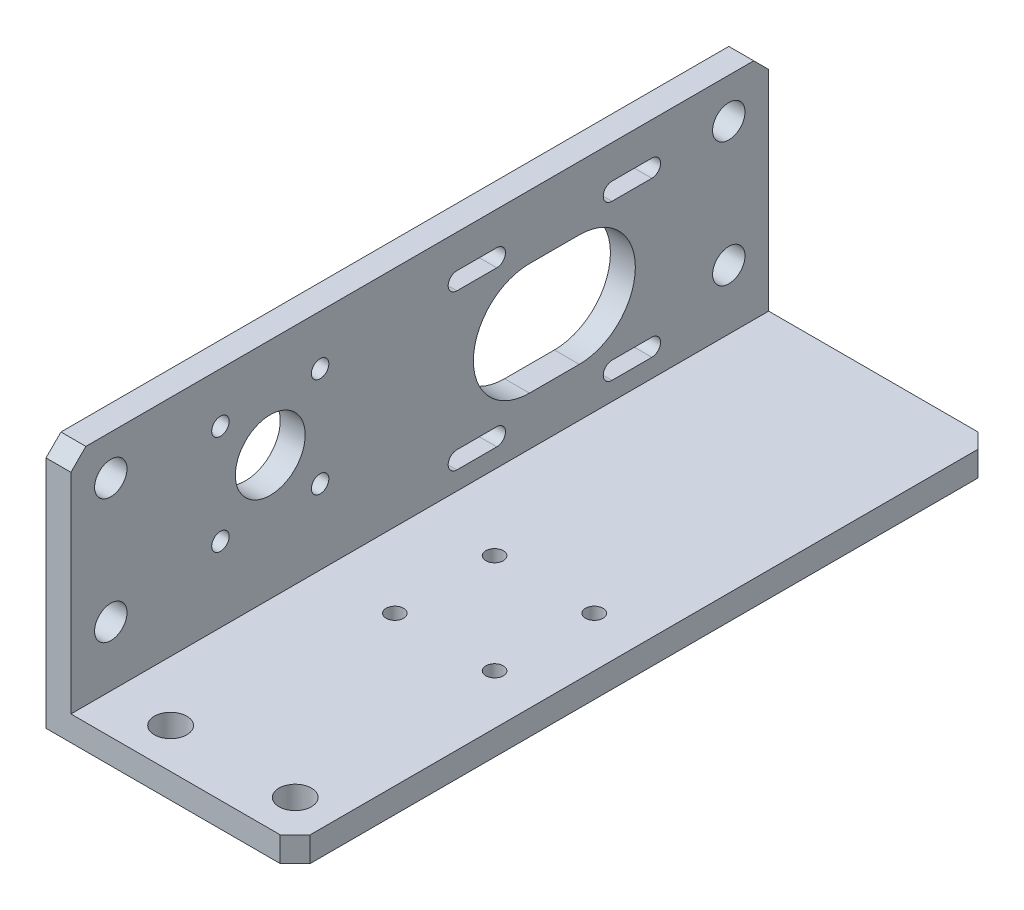
from build123d import *

# Parameters (mm, degrees)
ESTRUSIONE_ESTRUSIONE1_DEPTH = 140
FORO_6_5_6_5_1_D             = 6.5
FORO_6_5_6_5_2_AT_2_COUNT    = 2
FORO_6_5_6_5_2_AT_2_PITCH    = 25
TAGLIO_ESTRUSIONE1_REACH     = 158.844
SCHIZZO8_R                   = 1.75
TAGLIO_ESTRUSIONE2_REACH     = 158.844
SCHIZZO9_R                   = 1.75
SCHIZZO9_R_2                 = 7
TAGLIO_ESTRUSIONE4_REACH     = 158.844
SMUSSO1_SIZE                 = 3


with BuildPart() as part:
    # Schizzo1 → Estrusione-Estrusione1 (new body)
    with BuildSketch(Plane.XY):
        Polygon((0, 0), (0, 50), (5, 50), (5, 5), (50, 5), (50, 0), align=None)
    extrude(amount=ESTRUSIONE_ESTRUSIONE1_DEPTH)

    # Foro Ø6.5 (6.5)-1 (through all)
    with Locations(Plane(origin=(0, 0, 0), x_dir=(-1, 0, 0), z_dir=(0, -1, 0))):
        with Locations((-17, -132), (-42, -132)):
            Hole(FORO_6_5_6_5_1_D / 2)

    # Schizzo6 → Foro Ø6.5 (6.5)-2 (revolve, cut)
    with BuildSketch(Plane(origin=(0, 42, 132), x_dir=(0, 0, 1), z_dir=(0, 1, 0))):
        Polygon((0, 0), (0, 6.952797012), (3.25, 5), (3.25, 0), align=None)
    foro_6_5_6_5_2 = revolve(axis=Axis((-6.35, 42, 132), (1, 0, 0)), mode=Mode.SUBTRACT)

    # Foro Ø6.5 (6.5)-2 at 2: Foro Ø6.5 (6.5)-2 ×2
    with Locations(*[(0, -i * FORO_6_5_6_5_2_AT_2_PITCH, 0) for i in range(1, FORO_6_5_6_5_2_AT_2_COUNT)]):
        add(foro_6_5_6_5_2, mode=Mode.SUBTRACT)

    # Specchia1: Foro Ø6.5 (6.5)-2 across plane
    add(foro_6_5_6_5_2.mirror(Plane.XY.offset(70)), mode=Mode.SUBTRACT)

    # Specchia1 copy 1 sketch → Specchia1 copy 1 (revolve, cut)
    with BuildSketch(Plane(origin=(0, 17, 8), x_dir=(0, 0, -1), z_dir=(0, 1, 0))):
        Polygon((0, 0), (0, -6.952797012), (3.25, -5), (3.25, 0), align=None)
    revolve(axis=Axis((-6.35, 17, 8), (-1, 0, 0)), mode=Mode.SUBTRACT)

    # Schizzo8 → Taglio-Estrusione1 (cut, up to next)
    with BuildSketch(Plane.XZ, mode=Mode.PRIVATE) as taglio_estrusione1_sk1:
        with Locations((20, 70)):
            Circle(SCHIZZO8_R)
    taglio_estrusione1_tool1 = extrude(taglio_estrusione1_sk1.sketch, amount=-TAGLIO_ESTRUSIONE1_REACH, mode=Mode.PRIVATE) & part.part
    # Schizzo8 → Taglio-Estrusione1 (cut, up to next)
    with BuildSketch(Plane.XZ, mode=Mode.PRIVATE) as taglio_estrusione1_sk2:
        with Locations((20, 90)):
            Circle(SCHIZZO8_R)
    taglio_estrusione1_tool2 = extrude(taglio_estrusione1_sk2.sketch, amount=-TAGLIO_ESTRUSIONE1_REACH, mode=Mode.PRIVATE) & part.part
    # Schizzo8 → Taglio-Estrusione1 (cut, up to next)
    with BuildSketch(Plane.XZ, mode=Mode.PRIVATE) as taglio_estrusione1_sk3:
        with Locations((40, 90)):
            Circle(SCHIZZO8_R)
    taglio_estrusione1_tool3 = extrude(taglio_estrusione1_sk3.sketch, amount=-TAGLIO_ESTRUSIONE1_REACH, mode=Mode.PRIVATE) & part.part
    # Schizzo8 → Taglio-Estrusione1 (cut, up to next)
    with BuildSketch(Plane.XZ, mode=Mode.PRIVATE) as taglio_estrusione1_sk4:
        with Locations((40, 70)):
            Circle(SCHIZZO8_R)
    taglio_estrusione1_tool4 = extrude(taglio_estrusione1_sk4.sketch, amount=-TAGLIO_ESTRUSIONE1_REACH, mode=Mode.PRIVATE) & part.part
    add(taglio_estrusione1_tool1.solids().sort_by_distance((20, 0, 70))[0], mode=Mode.SUBTRACT)
    add(taglio_estrusione1_tool2.solids().sort_by_distance((20, 0, 90))[0], mode=Mode.SUBTRACT)
    add(taglio_estrusione1_tool3.solids().sort_by_distance((40, 0, 90))[0], mode=Mode.SUBTRACT)
    add(taglio_estrusione1_tool4.solids().sort_by_distance((40, 0, 70))[0], mode=Mode.SUBTRACT)

    # Schizzo9 → Taglio-Estrusione2 (cut, up to next)
    with BuildSketch(Plane.ZY, mode=Mode.PRIVATE) as taglio_estrusione2_sk1:
        with Locations((90, 40)):
            Circle(SCHIZZO9_R)
    taglio_estrusione2_tool1 = extrude(taglio_estrusione2_sk1.sketch, amount=-TAGLIO_ESTRUSIONE2_REACH, mode=Mode.PRIVATE) & part.part
    # Schizzo9 → Taglio-Estrusione2 (cut, up to next)
    with BuildSketch(Plane.ZY, mode=Mode.PRIVATE) as taglio_estrusione2_sk2:
        with Locations((110, 40)):
            Circle(SCHIZZO9_R)
    taglio_estrusione2_tool2 = extrude(taglio_estrusione2_sk2.sketch, amount=-TAGLIO_ESTRUSIONE2_REACH, mode=Mode.PRIVATE) & part.part
    # Schizzo9 → Taglio-Estrusione2 (cut, up to next)
    with BuildSketch(Plane.ZY, mode=Mode.PRIVATE) as taglio_estrusione2_sk3:
        with Locations((110, 20)):
            Circle(SCHIZZO9_R)
    taglio_estrusione2_tool3 = extrude(taglio_estrusione2_sk3.sketch, amount=-TAGLIO_ESTRUSIONE2_REACH, mode=Mode.PRIVATE) & part.part
    # Schizzo9 → Taglio-Estrusione2 (cut, up to next)
    with BuildSketch(Plane.ZY, mode=Mode.PRIVATE) as taglio_estrusione2_sk4:
        with Locations((90, 20)):
            Circle(SCHIZZO9_R)
    taglio_estrusione2_tool4 = extrude(taglio_estrusione2_sk4.sketch, amount=-TAGLIO_ESTRUSIONE2_REACH, mode=Mode.PRIVATE) & part.part
    # Schizzo9 → Taglio-Estrusione2 (cut, up to next)
    with BuildSketch(Plane.ZY, mode=Mode.PRIVATE) as taglio_estrusione2_sk5:
        with Locations((100, 30)):
            Circle(SCHIZZO9_R_2)
    taglio_estrusione2_tool5 = extrude(taglio_estrusione2_sk5.sketch, amount=-TAGLIO_ESTRUSIONE2_REACH, mode=Mode.PRIVATE) & part.part
    add(taglio_estrusione2_tool1.solids().sort_by_distance((0, 40, 90))[0], mode=Mode.SUBTRACT)
    add(taglio_estrusione2_tool2.solids().sort_by_distance((0, 40, 110))[0], mode=Mode.SUBTRACT)
    add(taglio_estrusione2_tool3.solids().sort_by_distance((0, 20, 110))[0], mode=Mode.SUBTRACT)
    add(taglio_estrusione2_tool4.solids().sort_by_distance((0, 20, 90))[0], mode=Mode.SUBTRACT)
    add(taglio_estrusione2_tool5.solids().sort_by_distance((0, 30, 100))[0], mode=Mode.SUBTRACT)

    # Schizzo11 → Taglio-Estrusione4 (cut, up to next)
    with BuildSketch(Plane.ZY, mode=Mode.PRIVATE) as taglio_estrusione4_sk1:
        with BuildLine():
            Line((62.556349186, 39.806349186), (54.556349186, 39.806349186))
            ThreePointArc((54.556349186, 39.806349186), (52.806349186, 41.556349186), (54.556349186, 43.306349186))
            Line((54.556349186, 43.306349186), (62.556349186, 43.306349186))
            ThreePointArc((62.556349186, 43.306349186), (64.306349186, 41.556349186), (62.556349186, 39.806349186))
        make_face()
    taglio_estrusione4_tool1 = extrude(taglio_estrusione4_sk1.sketch, amount=-TAGLIO_ESTRUSIONE4_REACH, mode=Mode.PRIVATE) & part.part
    # Schizzo11 → Taglio-Estrusione4 (cut, up to next)
    with BuildSketch(Plane.ZY, mode=Mode.PRIVATE) as taglio_estrusione4_sk2:
        with BuildLine():
            Line((62.556349186, 12.193650814), (54.556349186, 12.193650814))
            ThreePointArc((54.556349186, 12.193650814), (52.806349186, 10.443650814), (54.556349186, 8.693650814))
            Line((54.556349186, 8.693650814), (62.556349186, 8.693650814))
            ThreePointArc((62.556349186, 8.693650814), (64.306349186, 10.443650814), (62.556349186, 12.193650814))
        make_face()
    taglio_estrusione4_tool2 = extrude(taglio_estrusione4_sk2.sketch, amount=-TAGLIO_ESTRUSIONE4_REACH, mode=Mode.PRIVATE) & part.part
    # Schizzo11 → Taglio-Estrusione4 (cut, up to next)
    with BuildSketch(Plane.ZY, mode=Mode.PRIVATE) as taglio_estrusione4_sk3:
        with BuildLine():
            Line((23.443650814, 12.193650814), (31.443650814, 12.193650814))
            ThreePointArc((31.443650814, 12.193650814), (33.193650814, 10.443650814), (31.443650814, 8.693650814))
            Line((31.443650814, 8.693650814), (23.443650814, 8.693650814))
            ThreePointArc((23.443650814, 8.693650814), (21.693650814, 10.443650814), (23.443650814, 12.193650814))
        make_face()
    taglio_estrusione4_tool3 = extrude(taglio_estrusione4_sk3.sketch, amount=-TAGLIO_ESTRUSIONE4_REACH, mode=Mode.PRIVATE) & part.part
    # Schizzo11 → Taglio-Estrusione4 (cut, up to next)
    with BuildSketch(Plane.ZY, mode=Mode.PRIVATE) as taglio_estrusione4_sk4:
        with BuildLine():
            Line((23.443650814, 39.806349186), (31.443650814, 39.806349186))
            ThreePointArc((31.443650814, 39.806349186), (33.193650814, 41.556349186), (31.443650814, 43.306349186))
            Line((31.443650814, 43.306349186), (23.443650814, 43.306349186))
            ThreePointArc((23.443650814, 43.306349186), (21.693650814, 41.556349186), (23.443650814, 39.806349186))
        make_face()
    taglio_estrusione4_tool4 = extrude(taglio_estrusione4_sk4.sketch, amount=-TAGLIO_ESTRUSIONE4_REACH, mode=Mode.PRIVATE) & part.part
    # Schizzo11 → Taglio-Estrusione4 (cut, up to next)
    with BuildSketch(Plane.ZY, mode=Mode.PRIVATE) as taglio_estrusione4_sk5:
        with BuildLine():
            Line((48, 14.75), (38, 14.75))
            ThreePointArc((38, 14.75), (26.75, 26), (38, 37.25))
            Line((38, 37.25), (48, 37.25))
            ThreePointArc((48, 37.25), (59.25, 26), (48, 14.75))
        make_face()
    taglio_estrusione4_tool5 = extrude(taglio_estrusione4_sk5.sketch, amount=-TAGLIO_ESTRUSIONE4_REACH, mode=Mode.PRIVATE) & part.part
    add(taglio_estrusione4_tool1.solids().sort_by_distance((0, 41.556349, 58.556349))[0], mode=Mode.SUBTRACT)
    add(taglio_estrusione4_tool2.solids().sort_by_distance((0, 10.443651, 58.556349))[0], mode=Mode.SUBTRACT)
    add(taglio_estrusione4_tool3.solids().sort_by_distance((0, 10.443651, 27.443651))[0], mode=Mode.SUBTRACT)
    add(taglio_estrusione4_tool4.solids().sort_by_distance((0, 41.556349, 27.443651))[0], mode=Mode.SUBTRACT)
    add(taglio_estrusione4_tool5.solids().sort_by_distance((0, 26, 43))[0], mode=Mode.SUBTRACT)

    # Smusso1
    smusso1_edges = [part.edges().sort_by_distance(p)[0] for p in [
        (50, 2.5, 0),
        (2.5, 50, 0),
        (2.5, 50, 140),
        (50, 2.5, 140),
    ]]
    chamfer(smusso1_edges, length=SMUSSO1_SIZE)


solid = part.part
